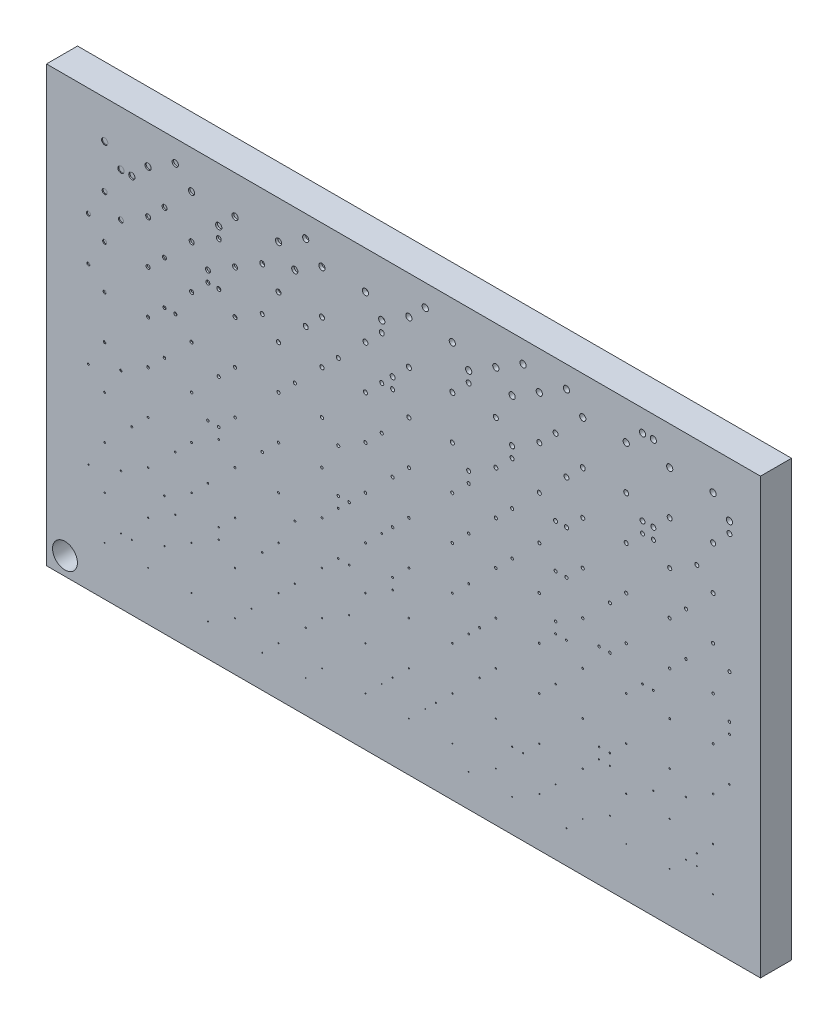
from build123d import *

# Parameters (mm, degrees)
SKETCH1_W            = 230
SKETCH1_H            = 140
BOSS_EXTRUDE1_DEPTH  = 10
SKETCH7_R            = 4
CUT_EXTRUDE5_DEPTH   = 10
SKETCH8_R            = 0.15
CUT_EXTRUDE6_DEPTH   = 0.3
SKETCH10_R           = 0.15
CUT_EXTRUDE7_DEPTH   = 0.4
SKETCH11_R           = 0.15
CUT_EXTRUDE8_DEPTH   = 0.5
SKETCH12_R           = 0.15
CUT_EXTRUDE9_DEPTH   = 0.6
SKETCH13_R           = 0.15
CUT_EXTRUDE10_DEPTH  = 0.8
SKETCH14_R           = 0.15
CUT_EXTRUDE11_DEPTH  = 1
SKETCH15_R           = 0.15
CUT_EXTRUDE12_DEPTH  = 1.3
SKETCH16_R           = 0.15
CUT_EXTRUDE13_DEPTH  = 1.6
SKETCH17_R           = 0.15
CUT_EXTRUDE14_DEPTH  = 2
SKETCH18_R           = 0.15
CUT_EXTRUDE15_DEPTH  = 2.5
SKETCH19_R           = 0.15
CUT_EXTRUDE16_DEPTH  = 3.2
SKETCH20_R           = 0.15
CUT_EXTRUDE17_DEPTH  = 4
SKETCH21_R           = 0.15
CUT_EXTRUDE18_DEPTH  = 5
SKETCH22_R           = 0.15
CUT_EXTRUDE19_DEPTH  = 6.3
SKETCH23_R           = 0.15
CUT_EXTRUDE20_DEPTH  = 8
SKETCH24_R           = 0.2
CUT_EXTRUDE21_DEPTH  = 0.3
SKETCH25_R           = 0.2
CUT_EXTRUDE22_DEPTH  = 0.4
SKETCH26_R           = 0.2
CUT_EXTRUDE23_DEPTH  = 0.5
SKETCH28_R           = 0.2
CUT_EXTRUDE25_DEPTH  = 0.6
SKETCH29_R           = 0.2
CUT_EXTRUDE26_DEPTH  = 0.8
SKETCH30_R           = 0.2
CUT_EXTRUDE27_DEPTH  = 1
SKETCH31_R           = 0.2
CUT_EXTRUDE28_DEPTH  = 1.3
SKETCH33_R           = 0.2
CUT_EXTRUDE29_DEPTH  = 1.6
SKETCH34_R           = 0.2
CUT_EXTRUDE30_DEPTH  = 2
SKETCH35_R           = 0.2
CUT_EXTRUDE31_DEPTH  = 2.5
SKETCH37_R           = 0.2
CUT_EXTRUDE32_DEPTH  = 3.2
SKETCH38_R           = 0.2
CUT_EXTRUDE33_DEPTH  = 4
SKETCH39_R           = 0.2
CUT_EXTRUDE34_DEPTH  = 5
SKETCH41_R           = 0.2
CUT_EXTRUDE35_DEPTH  = 6.3
SKETCH42_R           = 0.2
CUT_EXTRUDE36_DEPTH  = 8
SKETCH43_R           = 0.25
CUT_EXTRUDE37_DEPTH  = 0.3
SKETCH44_R           = 0.25
CUT_EXTRUDE38_DEPTH  = 0.4
SKETCH45_R           = 0.25
CUT_EXTRUDE39_DEPTH  = 0.5
SKETCH46_R           = 0.25
CUT_EXTRUDE40_DEPTH  = 0.6
SKETCH47_R           = 0.25
CUT_EXTRUDE41_DEPTH  = 0.8
SKETCH48_R           = 0.25
CUT_EXTRUDE42_DEPTH  = 1
SKETCH49_R           = 0.25
CUT_EXTRUDE43_DEPTH  = 1.3
SKETCH50_R           = 0.25
CUT_EXTRUDE44_DEPTH  = 1.6
SKETCH51_R           = 0.25
CUT_EXTRUDE45_DEPTH  = 2
SKETCH53_R           = 0.25
CUT_EXTRUDE46_DEPTH  = 2.5
SKETCH54_R           = 0.25
CUT_EXTRUDE47_DEPTH  = 3.2
SKETCH55_R           = 0.25
CUT_EXTRUDE48_DEPTH  = 4
SKETCH56_R           = 0.25
CUT_EXTRUDE49_DEPTH  = 5
SKETCH57_R           = 0.25
CUT_EXTRUDE50_DEPTH  = 6.3
SKETCH59_R           = 0.25
CUT_EXTRUDE51_DEPTH  = 8
SKETCH60_R           = 0.3
CUT_EXTRUDE52_DEPTH  = 0.3
SKETCH61_R           = 0.3
CUT_EXTRUDE53_DEPTH  = 0.4
SKETCH62_R           = 0.3
CUT_EXTRUDE54_DEPTH  = 0.5
SKETCH63_R           = 0.3
CUT_EXTRUDE55_DEPTH  = 0.6
SKETCH64_R           = 0.3
CUT_EXTRUDE56_DEPTH  = 0.8
SKETCH66_R           = 0.3
CUT_EXTRUDE57_DEPTH  = 1
SKETCH67_R           = 0.3
CUT_EXTRUDE58_DEPTH  = 1.3
SKETCH68_R           = 0.3
CUT_EXTRUDE59_DEPTH  = 1.6
SKETCH69_R           = 0.3
CUT_EXTRUDE60_DEPTH  = 2
SKETCH70_R           = 0.3
CUT_EXTRUDE61_DEPTH  = 2.5
SKETCH71_R           = 0.3
CUT_EXTRUDE62_DEPTH  = 3.2
SKETCH72_R           = 0.3
CUT_EXTRUDE63_DEPTH  = 4
SKETCH73_R           = 0.3
CUT_EXTRUDE64_DEPTH  = 5
SKETCH74_R           = 0.3
CUT_EXTRUDE65_DEPTH  = 6.3
SKETCH75_R           = 0.3
CUT_EXTRUDE66_DEPTH  = 8
SKETCH76_R           = 0.4
CUT_EXTRUDE67_DEPTH  = 0.3
SKETCH77_R           = 0.4
CUT_EXTRUDE68_DEPTH  = 0.4
SKETCH79_R           = 0.4
CUT_EXTRUDE69_DEPTH  = 0.5
SKETCH80_R           = 0.4
CUT_EXTRUDE70_DEPTH  = 0.6
SKETCH81_R           = 0.4
CUT_EXTRUDE71_DEPTH  = 0.8
SKETCH82_R           = 0.4
CUT_EXTRUDE72_DEPTH  = 1
SKETCH84_R           = 0.4
CUT_EXTRUDE73_DEPTH  = 1.3
SKETCH86_R           = 0.4
CUT_EXTRUDE74_DEPTH  = 1.6
SKETCH87_R           = 0.4
CUT_EXTRUDE75_DEPTH  = 2
SKETCH88_R           = 0.4
CUT_EXTRUDE76_DEPTH  = 2.5
SKETCH89_R           = 0.4
CUT_EXTRUDE77_DEPTH  = 3.2
SKETCH91_R           = 0.4
CUT_EXTRUDE78_DEPTH  = 4
SKETCH92_R           = 0.4
CUT_EXTRUDE79_DEPTH  = 5
SKETCH93_R           = 0.4
CUT_EXTRUDE80_DEPTH  = 6.3
SKETCH94_R           = 0.4
CUT_EXTRUDE81_DEPTH  = 8
SKETCH95_R           = 0.5
CUT_EXTRUDE82_DEPTH  = 0.3
SKETCH96_R           = 0.5
CUT_EXTRUDE83_DEPTH  = 0.4
SKETCH97_R           = 0.5
CUT_EXTRUDE84_DEPTH  = 0.5
SKETCH98_R           = 0.5
CUT_EXTRUDE85_DEPTH  = 0.6
SKETCH99_R           = 0.5
CUT_EXTRUDE86_DEPTH  = 0.8
SKETCH100_R          = 0.5
CUT_EXTRUDE87_DEPTH  = 1
SKETCH101_R          = 0.5
CUT_EXTRUDE88_DEPTH  = 1.3
SKETCH102_R          = 0.5
CUT_EXTRUDE89_DEPTH  = 1.6
SKETCH103_R          = 0.5
CUT_EXTRUDE90_DEPTH  = 2
SKETCH104_R          = 0.5
CUT_EXTRUDE91_DEPTH  = 2.5
SKETCH105_R          = 0.5
CUT_EXTRUDE92_DEPTH  = 3.2
SKETCH107_R          = 0.5
CUT_EXTRUDE93_DEPTH  = 4
SKETCH108_R          = 0.5
CUT_EXTRUDE94_DEPTH  = 5
SKETCH109_R          = 0.5
CUT_EXTRUDE95_DEPTH  = 6.3
SKETCH111_R          = 0.5
CUT_EXTRUDE96_DEPTH  = 8
SKETCH112_R          = 0.65
CUT_EXTRUDE97_DEPTH  = 0.3
SKETCH113_R          = 0.65
CUT_EXTRUDE98_DEPTH  = 0.4
SKETCH114_R          = 0.65
CUT_EXTRUDE99_DEPTH  = 0.5
SKETCH115_R          = 0.65
CUT_EXTRUDE100_DEPTH = 0.6
SKETCH116_R          = 0.65
CUT_EXTRUDE101_DEPTH = 0.8
SKETCH117_R          = 0.65
CUT_EXTRUDE102_DEPTH = 1
SKETCH118_R          = 0.65
CUT_EXTRUDE103_DEPTH = 1.3
SKETCH120_R          = 0.65
CUT_EXTRUDE104_DEPTH = 1.6
SKETCH121_R          = 0.65
CUT_EXTRUDE105_DEPTH = 2
SKETCH122_R          = 0.65
CUT_EXTRUDE106_DEPTH = 2.5
SKETCH124_R          = 0.65
CUT_EXTRUDE107_DEPTH = 3.2
SKETCH125_R          = 0.65
CUT_EXTRUDE108_DEPTH = 4
SKETCH127_R          = 0.65
CUT_EXTRUDE109_DEPTH = 5
SKETCH129_R          = 0.65
CUT_EXTRUDE110_DEPTH = 6.3
SKETCH130_R          = 0.65
CUT_EXTRUDE111_DEPTH = 8
SKETCH131_R          = 0.8
CUT_EXTRUDE112_DEPTH = 0.3
SKETCH132_R          = 0.8
CUT_EXTRUDE113_DEPTH = 0.4
SKETCH134_R          = 0.8
CUT_EXTRUDE114_DEPTH = 0.5
SKETCH135_R          = 0.8
CUT_EXTRUDE115_DEPTH = 0.6
SKETCH136_R          = 0.8
CUT_EXTRUDE116_DEPTH = 0.8
SKETCH137_R          = 0.8
CUT_EXTRUDE117_DEPTH = 1
SKETCH138_R          = 0.8
CUT_EXTRUDE118_DEPTH = 1.3
SKETCH139_R          = 0.8
CUT_EXTRUDE119_DEPTH = 1.6
SKETCH140_R          = 0.8
CUT_EXTRUDE120_DEPTH = 2
SKETCH141_R          = 0.8
CUT_EXTRUDE121_DEPTH = 2.5
SKETCH142_R          = 0.8
CUT_EXTRUDE122_DEPTH = 3.2
SKETCH143_R          = 0.8
CUT_EXTRUDE123_DEPTH = 4
SKETCH144_R          = 0.8
CUT_EXTRUDE124_DEPTH = 5
SKETCH145_R          = 0.8
CUT_EXTRUDE125_DEPTH = 6.3
SKETCH146_R          = 0.8
CUT_EXTRUDE126_DEPTH = 8
SKETCH147_R          = 1
CUT_EXTRUDE127_DEPTH = 0.3
SKETCH148_R          = 1
CUT_EXTRUDE128_DEPTH = 0.4
SKETCH149_R          = 1
CUT_EXTRUDE129_DEPTH = 0.5
SKETCH151_R          = 1
CUT_EXTRUDE130_DEPTH = 0.6
SKETCH152_R          = 1
CUT_EXTRUDE131_DEPTH = 0.8
SKETCH153_R          = 1
CUT_EXTRUDE132_DEPTH = 1
SKETCH154_R          = 1
CUT_EXTRUDE133_DEPTH = 1.3
SKETCH155_R          = 1
CUT_EXTRUDE134_DEPTH = 1.6
SKETCH156_R          = 1
CUT_EXTRUDE135_DEPTH = 2
SKETCH157_R          = 1
CUT_EXTRUDE136_DEPTH = 2.5
SKETCH158_R          = 1
CUT_EXTRUDE137_DEPTH = 3.2
SKETCH159_R          = 1
CUT_EXTRUDE138_DEPTH = 4
SKETCH160_R          = 1
CUT_EXTRUDE139_DEPTH = 5
SKETCH161_R          = 1
CUT_EXTRUDE140_DEPTH = 6.3
SKETCH162_R          = 1
CUT_EXTRUDE141_DEPTH = 8


with BuildPart() as part:
    # Sketch1 → Boss-Extrude1 (new body)
    with BuildSketch(Plane.XY):
        Rectangle(SKETCH1_W, SKETCH1_H)
    extrude(amount=BOSS_EXTRUDE1_DEPTH)

    # Sketch7 → Cut-Extrude5 (cut)
    with BuildSketch(Plane.XY.offset(10)):
        with Locations((-109.042941977, -64.201258826)):
            Circle(SKETCH7_R)
    extrude(amount=-CUT_EXTRUDE5_DEPTH, mode=Mode.SUBTRACT)

    # Sketch8 → Cut-Extrude6 (cut)
    with BuildSketch(Plane.XY.offset(10)):
        with Locations((-96.249943399, -54.249679787)):
            Circle(SKETCH8_R)
        with Locations((-90.999874337, -48.998924968)):
            Circle(SKETCH8_R)
    extrude(amount=-CUT_EXTRUDE6_DEPTH, mode=Mode.SUBTRACT)

    # Sketch10 → Cut-Extrude7 (cut)
    with BuildSketch(Plane.XY.offset(10)):
        with Locations((-82.249491037, -54.249550816)):
            Circle(SKETCH10_R)
        with Locations((-87.501475083, -49.000981168)):
            Circle(SKETCH10_R)
    extrude(amount=-CUT_EXTRUDE7_DEPTH, mode=Mode.SUBTRACT)

    # Sketch11 → Cut-Extrude8 (cut)
    with BuildSketch(Plane.XY.offset(10)):
        with Locations((-68.261838039, -54.252904313)):
            Circle(SKETCH11_R)
        with Locations((-62.981710508, -59.519060019)):
            Circle(SKETCH11_R)
    extrude(amount=-CUT_EXTRUDE8_DEPTH, mode=Mode.SUBTRACT)

    # Sketch12 → Cut-Extrude9 (cut)
    with BuildSketch(Plane.XY.offset(10)):
        with Locations((-54.252810099, -54.248506301)):
            Circle(SKETCH12_R)
        with Locations((-49.000661176, -49.000211981)):
            Circle(SKETCH12_R)
    extrude(amount=-CUT_EXTRUDE9_DEPTH, mode=Mode.SUBTRACT)

    # Sketch13 → Cut-Extrude10 (cut)
    with BuildSketch(Plane.XY.offset(10)):
        with Locations((-40.253624595, -54.25930312)):
            Circle(SKETCH13_R)
        with Locations((-45.507827791, -59.507162167)):
            Circle(SKETCH13_R)
    extrude(amount=-CUT_EXTRUDE10_DEPTH, mode=Mode.SUBTRACT)

    # Sketch14 → Cut-Extrude11 (cut)
    with BuildSketch(Plane.XY.offset(10)):
        with Locations((-26.249884398, -54.24764395)):
            Circle(SKETCH14_R)
        with Locations((-31.499792921, -59.499721302)):
            Circle(SKETCH14_R)
    extrude(amount=-CUT_EXTRUDE11_DEPTH, mode=Mode.SUBTRACT)

    # Sketch15 → Cut-Extrude12 (cut)
    with BuildSketch(Plane.XY.offset(10)):
        with Locations((-12.250506084, -54.250247714)):
            Circle(SKETCH15_R)
        with Locations((-6.999236045, -49.000434159)):
            Circle(SKETCH15_R)
    extrude(amount=-CUT_EXTRUDE12_DEPTH, mode=Mode.SUBTRACT)

    # Sketch16 → Cut-Extrude13 (cut)
    with BuildSketch(Plane.XY.offset(10)):
        with Locations((1.750604588, -54.251162541)):
            Circle(SKETCH16_R)
        with Locations((7.000082749, -49.000605939)):
            Circle(SKETCH16_R)
    extrude(amount=-CUT_EXTRUDE13_DEPTH, mode=Mode.SUBTRACT)

    # Sketch17 → Cut-Extrude14 (cut)
    with BuildSketch(Plane.XY.offset(10)):
        with Locations((15.750210434, -54.250994624)):
            Circle(SKETCH17_R)
        with Locations((20.999440385, -59.501475674)):
            Circle(SKETCH17_R)
    extrude(amount=-CUT_EXTRUDE14_DEPTH, mode=Mode.SUBTRACT)

    # Sketch18 → Cut-Extrude15 (cut)
    with BuildSketch(Plane.XY.offset(10)):
        with Locations((29.752072794, -54.247371691)):
            Circle(SKETCH18_R)
        with Locations((35.00012008, -59.500341576)):
            Circle(SKETCH18_R)
    extrude(amount=-CUT_EXTRUDE15_DEPTH, mode=Mode.SUBTRACT)

    # Sketch19 → Cut-Extrude16 (cut)
    with BuildSketch(Plane.XY.offset(10)):
        with Locations((43.774415439, -54.237890934)):
            Circle(SKETCH19_R)
        with Locations((49.016100038, -49.026342575)):
            Circle(SKETCH19_R)
    extrude(amount=-CUT_EXTRUDE16_DEPTH, mode=Mode.SUBTRACT)

    # Sketch20 → Cut-Extrude17 (cut)
    with BuildSketch(Plane.XY.offset(10)):
        with Locations((57.746432811, -54.253474775)):
            Circle(SKETCH20_R)
        with Locations((52.499861717, -59.500791765)):
            Circle(SKETCH20_R)
    extrude(amount=-CUT_EXTRUDE17_DEPTH, mode=Mode.SUBTRACT)

    # Sketch21 → Cut-Extrude18 (cut)
    with BuildSketch(Plane.XY.offset(10)):
        with Locations((71.750133446, -54.253155508)):
            Circle(SKETCH21_R)
        with Locations((66.500129392, -48.999906121)):
            Circle(SKETCH21_R)
    extrude(amount=-CUT_EXTRUDE18_DEPTH, mode=Mode.SUBTRACT)

    # Sketch22 → Cut-Extrude19 (cut)
    with BuildSketch(Plane.XY.offset(10)):
        with Locations((85.750887917, -54.253149119)):
            Circle(SKETCH22_R)
        with Locations((91.000252872, -49.001105902)):
            Circle(SKETCH22_R)
    extrude(amount=-CUT_EXTRUDE19_DEPTH, mode=Mode.SUBTRACT)

    # Sketch23 → Cut-Extrude20 (cut)
    with BuildSketch(Plane.XY.offset(10)):
        with Locations((99.749573037, -54.251102866)):
            Circle(SKETCH23_R)
        with Locations((94.498823547, -49.001471895)):
            Circle(SKETCH23_R)
    extrude(amount=-CUT_EXTRUDE20_DEPTH, mode=Mode.SUBTRACT)

    # Sketch24 → Cut-Extrude21 (cut)
    with BuildSketch(Plane.XY.offset(10)):
        with Locations((-96.248580982, -40.246762901)):
            Circle(SKETCH24_R)
        with Locations((-101.487437659, -35.005366334)):
            Circle(SKETCH24_R)
    extrude(amount=-CUT_EXTRUDE21_DEPTH, mode=Mode.SUBTRACT)

    # Sketch25 → Cut-Extrude22 (cut)
    with BuildSketch(Plane.XY.offset(10)):
        with Locations((-82.247762838, -40.256089431)):
            Circle(SKETCH25_R)
        with Locations((-76.998898501, -45.499448138)):
            Circle(SKETCH25_R)
    extrude(amount=-CUT_EXTRUDE22_DEPTH, mode=Mode.SUBTRACT)

    # Sketch26 → Cut-Extrude23 (cut)
    with BuildSketch(Plane.XY.offset(10)):
        with Locations((-68.241657512, -40.258834454)):
            Circle(SKETCH26_R)
        with Locations((-73.49008197, -34.995352001)):
            Circle(SKETCH26_R)
    extrude(amount=-CUT_EXTRUDE23_DEPTH, mode=Mode.SUBTRACT)

    # Sketch28 → Cut-Extrude25 (cut)
    with BuildSketch(Plane.XY.offset(10)):
        with Locations((-54.250214592, -40.255115508)):
            Circle(SKETCH28_R)
        with Locations((-59.501935253, -35.004284698)):
            Circle(SKETCH28_R)
    extrude(amount=-CUT_EXTRUDE25_DEPTH, mode=Mode.SUBTRACT)

    # Sketch29 → Cut-Extrude26 (cut)
    with BuildSketch(Plane.XY.offset(10)):
        with Locations((-40.255041187, -40.251054217)):
            Circle(SKETCH29_R)
        with Locations((-34.998488594, -35.002201595)):
            Circle(SKETCH29_R)
    extrude(amount=-CUT_EXTRUDE26_DEPTH, mode=Mode.SUBTRACT)

    # Sketch30 → Cut-Extrude27 (cut)
    with BuildSketch(Plane.XY.offset(10)):
        with Locations((-26.247963529, -40.254747535)):
            Circle(SKETCH30_R)
        with Locations((-31.498700128, -45.51436591)):
            Circle(SKETCH30_R)
    extrude(amount=-CUT_EXTRUDE27_DEPTH, mode=Mode.SUBTRACT)

    # Sketch31 → Cut-Extrude28 (cut)
    with BuildSketch(Plane.XY.offset(10)):
        with Locations((-12.248658261, -40.248036469)):
            Circle(SKETCH31_R)
        with Locations((-17.505338259, -34.998920094)):
            Circle(SKETCH31_R)
    extrude(amount=-CUT_EXTRUDE28_DEPTH, mode=Mode.SUBTRACT)

    # Sketch33 → Cut-Extrude29 (cut)
    with BuildSketch(Plane.XY.offset(10)):
        with Locations((1.753113594, -40.247359153)):
            Circle(SKETCH33_R)
        with Locations((-3.505543052, -45.503072676)):
            Circle(SKETCH33_R)
    extrude(amount=-CUT_EXTRUDE29_DEPTH, mode=Mode.SUBTRACT)

    # Sketch34 → Cut-Extrude30 (cut)
    with BuildSketch(Plane.XY.offset(10)):
        with Locations((15.75256569, -40.253964375)):
            Circle(SKETCH34_R)
        with Locations((10.50057115, -45.502722883)):
            Circle(SKETCH34_R)
    extrude(amount=-CUT_EXTRUDE30_DEPTH, mode=Mode.SUBTRACT)

    # Sketch35 → Cut-Extrude31 (cut)
    with BuildSketch(Plane.XY.offset(10)):
        with Locations((29.748102112, -40.247524967)):
            Circle(SKETCH35_R)
        with Locations((35.004594047, -45.50551431)):
            Circle(SKETCH35_R)
    extrude(amount=-CUT_EXTRUDE31_DEPTH, mode=Mode.SUBTRACT)

    # Sketch37 → Cut-Extrude32 (cut)
    with BuildSketch(Plane.XY.offset(10)):
        with Locations((43.752366978, -40.251913533)):
            Circle(SKETCH37_R)
        with Locations((38.496933643, -45.506209212)):
            Circle(SKETCH37_R)
    extrude(amount=-CUT_EXTRUDE32_DEPTH, mode=Mode.SUBTRACT)

    # Sketch38 → Cut-Extrude33 (cut)
    with BuildSketch(Plane.XY.offset(10)):
        with Locations((57.749027025, -40.250908504)):
            Circle(SKETCH38_R)
        with Locations((63.002579099, -35.016712104)):
            Circle(SKETCH38_R)
    extrude(amount=-CUT_EXTRUDE33_DEPTH, mode=Mode.SUBTRACT)

    # Sketch39 → Cut-Extrude34 (cut)
    with BuildSketch(Plane.XY.offset(10)):
        with Locations((71.749376563, -40.251866978)):
            Circle(SKETCH39_R)
        with Locations((66.503102808, -35.018953964)):
            Circle(SKETCH39_R)
    extrude(amount=-CUT_EXTRUDE34_DEPTH, mode=Mode.SUBTRACT)

    # Sketch41 → Cut-Extrude35 (cut)
    with BuildSketch(Plane.XY.offset(10)):
        with Locations((85.75304853, -40.249924221)):
            Circle(SKETCH41_R)
        with Locations((80.492907487, -35.000078663)):
            Circle(SKETCH41_R)
    extrude(amount=-CUT_EXTRUDE35_DEPTH, mode=Mode.SUBTRACT)

    # Sketch42 → Cut-Extrude36 (cut)
    with BuildSketch(Plane.XY.offset(10)):
        with Locations((99.748726349, -40.250300142)):
            Circle(SKETCH42_R)
        with Locations((94.499191724, -45.499275702)):
            Circle(SKETCH42_R)
    extrude(amount=-CUT_EXTRUDE36_DEPTH, mode=Mode.SUBTRACT)

    # Sketch43 → Cut-Extrude37 (cut)
    with BuildSketch(Plane.XY.offset(10)):
        with Locations((-96.258260655, -26.246155762)):
            Circle(SKETCH43_R)
        with Locations((-90.995156769, -31.508068016)):
            Circle(SKETCH43_R)
    extrude(amount=-CUT_EXTRUDE37_DEPTH, mode=Mode.SUBTRACT)

    # Sketch44 → Cut-Extrude38 (cut)
    with BuildSketch(Plane.XY.offset(10)):
        with Locations((-82.246236366, -26.246781643)):
            Circle(SKETCH44_R)
        with Locations((-76.996676425, -31.506208621)):
            Circle(SKETCH44_R)
    extrude(amount=-CUT_EXTRUDE38_DEPTH, mode=Mode.SUBTRACT)

    # Sketch45 → Cut-Extrude39 (cut)
    with BuildSketch(Plane.XY.offset(10)):
        with Locations((-68.245839858, -26.254858809)):
            Circle(SKETCH45_R)
        with Locations((-63.001301145, -21.00345891)):
            Circle(SKETCH45_R)
    extrude(amount=-CUT_EXTRUDE39_DEPTH, mode=Mode.SUBTRACT)

    # Sketch46 → Cut-Extrude40 (cut)
    with BuildSketch(Plane.XY.offset(10)):
        with Locations((-54.253861977, -26.252451768)):
            Circle(SKETCH46_R)
        with Locations((-59.504120315, -31.513139409)):
            Circle(SKETCH46_R)
    extrude(amount=-CUT_EXTRUDE40_DEPTH, mode=Mode.SUBTRACT)

    # Sketch47 → Cut-Extrude41 (cut)
    with BuildSketch(Plane.XY.offset(10)):
        with Locations((-40.248888006, -26.252967104)):
            Circle(SKETCH47_R)
        with Locations((-45.498075131, -31.502017026)):
            Circle(SKETCH47_R)
    extrude(amount=-CUT_EXTRUDE41_DEPTH, mode=Mode.SUBTRACT)

    # Sketch48 → Cut-Extrude42 (cut)
    with BuildSketch(Plane.XY.offset(10)):
        with Locations((-26.249534477, -26.252292502)):
            Circle(SKETCH48_R)
        with Locations((-21.000233226, -21.001330328)):
            Circle(SKETCH48_R)
    extrude(amount=-CUT_EXTRUDE42_DEPTH, mode=Mode.SUBTRACT)

    # Sketch49 → Cut-Extrude43 (cut)
    with BuildSketch(Plane.XY.offset(10)):
        with Locations((-12.250518947, -26.263174953)):
            Circle(SKETCH49_R)
        with Locations((-17.498656895, -21.001685128)):
            Circle(SKETCH49_R)
    extrude(amount=-CUT_EXTRUDE43_DEPTH, mode=Mode.SUBTRACT)

    # Sketch50 → Cut-Extrude44 (cut)
    with BuildSketch(Plane.XY.offset(10)):
        with Locations((1.747078239, -26.250665841)):
            Circle(SKETCH50_R)
        with Locations((-3.499137814, -21.000073457)):
            Circle(SKETCH50_R)
    extrude(amount=-CUT_EXTRUDE44_DEPTH, mode=Mode.SUBTRACT)

    # Sketch51 → Cut-Extrude45 (cut)
    with BuildSketch(Plane.XY.offset(10)):
        with Locations((15.74714847, -26.253750394)):
            Circle(SKETCH51_R)
        with Locations((21.005127475, -21.001038767)):
            Circle(SKETCH51_R)
    extrude(amount=-CUT_EXTRUDE45_DEPTH, mode=Mode.SUBTRACT)

    # Sketch53 → Cut-Extrude46 (cut)
    with BuildSketch(Plane.XY.offset(10)):
        with Locations((29.749468874, -26.252393022)):
            Circle(SKETCH53_R)
        with Locations((24.498265186, -31.504435786)):
            Circle(SKETCH53_R)
    extrude(amount=-CUT_EXTRUDE46_DEPTH, mode=Mode.SUBTRACT)

    # Sketch54 → Cut-Extrude47 (cut)
    with BuildSketch(Plane.XY.offset(10)):
        with Locations((43.745660862, -26.251733364)):
            Circle(SKETCH54_R)
        with Locations((48.998900888, -21.004340385)):
            Circle(SKETCH54_R)
    extrude(amount=-CUT_EXTRUDE47_DEPTH, mode=Mode.SUBTRACT)

    # Sketch55 → Cut-Extrude48 (cut)
    with BuildSketch(Plane.XY.offset(10)):
        with Locations((57.758821326, -26.252380091)):
            Circle(SKETCH55_R)
        with Locations((62.998459982, -31.50919707)):
            Circle(SKETCH55_R)
    extrude(amount=-CUT_EXTRUDE48_DEPTH, mode=Mode.SUBTRACT)

    # Sketch56 → Cut-Extrude49 (cut)
    with BuildSketch(Plane.XY.offset(10)):
        with Locations((71.750106799, -26.2511108)):
            Circle(SKETCH56_R)
        with Locations((66.499773166, -31.496255601)):
            Circle(SKETCH56_R)
    extrude(amount=-CUT_EXTRUDE49_DEPTH, mode=Mode.SUBTRACT)

    # Sketch57 → Cut-Extrude50 (cut)
    with BuildSketch(Plane.XY.offset(10)):
        with Locations((85.745680987, -26.246276163)):
            Circle(SKETCH57_R)
        with Locations((91.000977888, -31.499259395)):
            Circle(SKETCH57_R)
    extrude(amount=-CUT_EXTRUDE50_DEPTH, mode=Mode.SUBTRACT)

    # Sketch59 → Cut-Extrude51 (cut)
    with BuildSketch(Plane.XY.offset(10)):
        with Locations((99.745130194, -26.257684623)):
            Circle(SKETCH59_R)
        with Locations((104.997528224, -21.00814684)):
            Circle(SKETCH59_R)
    extrude(amount=-CUT_EXTRUDE51_DEPTH, mode=Mode.SUBTRACT)

    # Sketch60 → Cut-Extrude52 (cut)
    with BuildSketch(Plane.XY.offset(10)):
        with Locations((-96.25461941, -12.254982082)):
            Circle(SKETCH60_R)
        with Locations((-101.496054707, -7.001558372)):
            Circle(SKETCH60_R)
    extrude(amount=-CUT_EXTRUDE52_DEPTH, mode=Mode.SUBTRACT)

    # Sketch61 → Cut-Extrude53 (cut)
    with BuildSketch(Plane.XY.offset(10)):
        with Locations((-82.249702768, -12.255549457)):
            Circle(SKETCH61_R)
        with Locations((-87.495433778, -17.508401752)):
            Circle(SKETCH61_R)
    extrude(amount=-CUT_EXTRUDE53_DEPTH, mode=Mode.SUBTRACT)

    # Sketch62 → Cut-Extrude54 (cut)
    with BuildSketch(Plane.XY.offset(10)):
        with Locations((-68.256273037, -12.252316731)):
            Circle(SKETCH62_R)
        with Locations((-73.499195041, -17.499822394)):
            Circle(SKETCH62_R)
    extrude(amount=-CUT_EXTRUDE54_DEPTH, mode=Mode.SUBTRACT)

    # Sketch63 → Cut-Extrude55 (cut)
    with BuildSketch(Plane.XY.offset(10)):
        with Locations((-54.261477101, -12.254031728)):
            Circle(SKETCH63_R)
        with Locations((-59.503654233, -7.013051134)):
            Circle(SKETCH63_R)
    extrude(amount=-CUT_EXTRUDE55_DEPTH, mode=Mode.SUBTRACT)

    # Sketch64 → Cut-Extrude56 (cut)
    with BuildSketch(Plane.XY.offset(10)):
        with Locations((-40.256412294, -12.25990674)):
            Circle(SKETCH64_R)
        with Locations((-34.985105884, -17.510019631)):
            Circle(SKETCH64_R)
    extrude(amount=-CUT_EXTRUDE56_DEPTH, mode=Mode.SUBTRACT)

    # Sketch66 → Cut-Extrude57 (cut)
    with BuildSketch(Plane.XY.offset(10)):
        with Locations((-26.249363164, -12.256234414)):
            Circle(SKETCH66_R)
        with Locations((-20.995782229, -7.000188989)):
            Circle(SKETCH66_R)
    extrude(amount=-CUT_EXTRUDE57_DEPTH, mode=Mode.SUBTRACT)

    # Sketch67 → Cut-Extrude58 (cut)
    with BuildSketch(Plane.XY.offset(10)):
        with Locations((-12.235726323, -12.244715067)):
            Circle(SKETCH67_R)
        with Locations((-6.992278399, -6.992240498)):
            Circle(SKETCH67_R)
    extrude(amount=-CUT_EXTRUDE58_DEPTH, mode=Mode.SUBTRACT)

    # Sketch68 → Cut-Extrude59 (cut)
    with BuildSketch(Plane.XY.offset(10)):
        with Locations((1.754534448, -12.255377325)):
            Circle(SKETCH68_R)
        with Locations((-3.502755421, -17.512225307)):
            Circle(SKETCH68_R)
    extrude(amount=-CUT_EXTRUDE59_DEPTH, mode=Mode.SUBTRACT)

    # Sketch69 → Cut-Extrude60 (cut)
    with BuildSketch(Plane.XY.offset(10)):
        with Locations((15.744877643, -12.256861819)):
            Circle(SKETCH69_R)
        with Locations((21.009841361, -7.006344924)):
            Circle(SKETCH69_R)
    extrude(amount=-CUT_EXTRUDE60_DEPTH, mode=Mode.SUBTRACT)

    # Sketch70 → Cut-Extrude61 (cut)
    with BuildSketch(Plane.XY.offset(10)):
        with Locations((29.750196944, -12.25523678)):
            Circle(SKETCH70_R)
        with Locations((24.508410735, -17.507782073)):
            Circle(SKETCH70_R)
    extrude(amount=-CUT_EXTRUDE61_DEPTH, mode=Mode.SUBTRACT)

    # Sketch71 → Cut-Extrude62 (cut)
    with BuildSketch(Plane.XY.offset(10)):
        with Locations((43.749681369, -12.247569805)):
            Circle(SKETCH71_R)
        with Locations((49.010128442, -7.012307344)):
            Circle(SKETCH71_R)
    extrude(amount=-CUT_EXTRUDE62_DEPTH, mode=Mode.SUBTRACT)

    # Sketch72 → Cut-Extrude63 (cut)
    with BuildSketch(Plane.XY.offset(10)):
        with Locations((57.751822731, -12.250577711)):
            Circle(SKETCH72_R)
        with Locations((52.507482907, -7.006693568)):
            Circle(SKETCH72_R)
    extrude(amount=-CUT_EXTRUDE63_DEPTH, mode=Mode.SUBTRACT)

    # Sketch73 → Cut-Extrude64 (cut)
    with BuildSketch(Plane.XY.offset(10)):
        with Locations((71.751379788, -12.256276649)):
            Circle(SKETCH73_R)
        with Locations((77.008894323, -7.000614382)):
            Circle(SKETCH73_R)
    extrude(amount=-CUT_EXTRUDE64_DEPTH, mode=Mode.SUBTRACT)

    # Sketch74 → Cut-Extrude65 (cut)
    with BuildSketch(Plane.XY.offset(10)):
        with Locations((85.747522124, -12.255884681)):
            Circle(SKETCH74_R)
        with Locations((80.48721955, -7.017622462)):
            Circle(SKETCH74_R)
    extrude(amount=-CUT_EXTRUDE65_DEPTH, mode=Mode.SUBTRACT)

    # Sketch75 → Cut-Extrude66 (cut)
    with BuildSketch(Plane.XY.offset(10)):
        with Locations((99.750293157, -12.246014661)):
            Circle(SKETCH75_R)
        with Locations((105.008200327, -7.001854225)):
            Circle(SKETCH75_R)
    extrude(amount=-CUT_EXTRUDE66_DEPTH, mode=Mode.SUBTRACT)

    # Sketch76 → Cut-Extrude67 (cut)
    with BuildSketch(Plane.XY.offset(10)):
        with Locations((-96.256583394, 1.745037788)):
            Circle(SKETCH76_R)
        with Locations((-91.013760875, -3.510944558)):
            Circle(SKETCH76_R)
    extrude(amount=-CUT_EXTRUDE67_DEPTH, mode=Mode.SUBTRACT)

    # Sketch77 → Cut-Extrude68 (cut)
    with BuildSketch(Plane.XY.offset(10)):
        with Locations((-82.267945504, 1.74429573)):
            Circle(SKETCH77_R)
        with Locations((-76.99594702, 7.011009175)):
            Circle(SKETCH77_R)
    extrude(amount=-CUT_EXTRUDE68_DEPTH, mode=Mode.SUBTRACT)

    # Sketch79 → Cut-Extrude69 (cut)
    with BuildSketch(Plane.XY.offset(10)):
        with Locations((-68.243934678, 1.733705426)):
            Circle(SKETCH79_R)
        with Locations((-62.996167745, -3.503696544)):
            Circle(SKETCH79_R)
    extrude(amount=-CUT_EXTRUDE69_DEPTH, mode=Mode.SUBTRACT)

    # Sketch80 → Cut-Extrude70 (cut)
    with BuildSketch(Plane.XY.offset(10)):
        with Locations((-54.251249908, 1.765534097)):
            Circle(SKETCH80_R)
        with Locations((-59.520350985, -3.520379165)):
            Circle(SKETCH80_R)
    extrude(amount=-CUT_EXTRUDE70_DEPTH, mode=Mode.SUBTRACT)

    # Sketch81 → Cut-Extrude71 (cut)
    with BuildSketch(Plane.XY.offset(10)):
        with Locations((-40.248153453, 1.749155114)):
            Circle(SKETCH81_R)
        with Locations((-45.500869729, -3.498012955)):
            Circle(SKETCH81_R)
    extrude(amount=-CUT_EXTRUDE71_DEPTH, mode=Mode.SUBTRACT)

    # Sketch82 → Cut-Extrude72 (cut)
    with BuildSketch(Plane.XY.offset(10)):
        with Locations((-26.275244446, 1.747317935)):
            Circle(SKETCH82_R)
        with Locations((-20.995127723, -3.511666179)):
            Circle(SKETCH82_R)
    extrude(amount=-CUT_EXTRUDE72_DEPTH, mode=Mode.SUBTRACT)

    # Sketch84 → Cut-Extrude73 (cut)
    with BuildSketch(Plane.XY.offset(10)):
        with Locations((-17.49932612, -3.50528826)):
            Circle(SKETCH84_R)
        with Locations((-12.25260791, 1.741448509)):
            Circle(SKETCH84_R)
    extrude(amount=-CUT_EXTRUDE73_DEPTH, mode=Mode.SUBTRACT)

    # Sketch86 → Cut-Extrude74 (cut)
    with BuildSketch(Plane.XY.offset(10)):
        with Locations((1.745039535, 1.741339349)):
            Circle(SKETCH86_R)
        with Locations((-3.495151051, -3.499839168)):
            Circle(SKETCH86_R)
    extrude(amount=-CUT_EXTRUDE74_DEPTH, mode=Mode.SUBTRACT)

    # Sketch87 → Cut-Extrude75 (cut)
    with BuildSketch(Plane.XY.offset(10)):
        with Locations((15.753560639, 1.741921375)):
            Circle(SKETCH87_R)
        with Locations((20.998717742, 6.99455625)):
            Circle(SKETCH87_R)
    extrude(amount=-CUT_EXTRUDE75_DEPTH, mode=Mode.SUBTRACT)

    # Sketch88 → Cut-Extrude76 (cut)
    with BuildSketch(Plane.XY.offset(10)):
        with Locations((29.752879785, 1.744489346)):
            Circle(SKETCH88_R)
        with Locations((34.998072316, 6.999515852)):
            Circle(SKETCH88_R)
    extrude(amount=-CUT_EXTRUDE76_DEPTH, mode=Mode.SUBTRACT)

    # Sketch89 → Cut-Extrude77 (cut)
    with BuildSketch(Plane.XY.offset(10)):
        with Locations((43.75017786, 1.745936963)):
            Circle(SKETCH89_R)
        with Locations((49.005887391, -3.502826203)):
            Circle(SKETCH89_R)
    extrude(amount=-CUT_EXTRUDE77_DEPTH, mode=Mode.SUBTRACT)

    # Sketch91 → Cut-Extrude78 (cut)
    with BuildSketch(Plane.XY.offset(10)):
        with Locations((57.753720356, 1.743193014)):
            Circle(SKETCH91_R)
        with Locations((62.997964049, -3.506252634)):
            Circle(SKETCH91_R)
    extrude(amount=-CUT_EXTRUDE78_DEPTH, mode=Mode.SUBTRACT)

    # Sketch92 → Cut-Extrude79 (cut)
    with BuildSketch(Plane.XY.offset(10)):
        with Locations((71.755179572, 1.748871745)):
            Circle(SKETCH92_R)
        with Locations((66.500637637, -3.508095525)):
            Circle(SKETCH92_R)
    extrude(amount=-CUT_EXTRUDE79_DEPTH, mode=Mode.SUBTRACT)

    # Sketch93 → Cut-Extrude80 (cut)
    with BuildSketch(Plane.XY.offset(10)):
        with Locations((85.750811485, 1.745076542)):
            Circle(SKETCH93_R)
        with Locations((91.001271487, 6.997269486)):
            Circle(SKETCH93_R)
    extrude(amount=-CUT_EXTRUDE80_DEPTH, mode=Mode.SUBTRACT)

    # Sketch94 → Cut-Extrude81 (cut)
    with BuildSketch(Plane.XY.offset(10)):
        with Locations((99.746171259, 1.752722936)):
            Circle(SKETCH94_R)
        with Locations((104.99891717, -3.502294608)):
            Circle(SKETCH94_R)
    extrude(amount=-CUT_EXTRUDE81_DEPTH, mode=Mode.SUBTRACT)

    # Sketch95 → Cut-Extrude82 (cut)
    with BuildSketch(Plane.XY.offset(10)):
        with Locations((-96.250638493, 15.744057262)):
            Circle(SKETCH95_R)
        with Locations((-101.502974448, 20.988191795)):
            Circle(SKETCH95_R)
    extrude(amount=-CUT_EXTRUDE82_DEPTH, mode=Mode.SUBTRACT)

    # Sketch96 → Cut-Extrude83 (cut)
    with BuildSketch(Plane.XY.offset(10)):
        with Locations((-82.24798045, 15.745788469)):
            Circle(SKETCH96_R)
        with Locations((-77.005498583, 21.006159684)):
            Circle(SKETCH96_R)
    extrude(amount=-CUT_EXTRUDE83_DEPTH, mode=Mode.SUBTRACT)

    # Sketch97 → Cut-Extrude84 (cut)
    with BuildSketch(Plane.XY.offset(10)):
        with Locations((-68.278960707, 15.760908762)):
            Circle(SKETCH97_R)
        with Locations((-73.503502628, 20.997795266)):
            Circle(SKETCH97_R)
    extrude(amount=-CUT_EXTRUDE84_DEPTH, mode=Mode.SUBTRACT)

    # Sketch98 → Cut-Extrude85 (cut)
    with BuildSketch(Plane.XY.offset(10)):
        with Locations((-54.254299355, 15.726426503)):
            Circle(SKETCH98_R)
        with Locations((-59.508179062, 10.505249293)):
            Circle(SKETCH98_R)
    extrude(amount=-CUT_EXTRUDE85_DEPTH, mode=Mode.SUBTRACT)

    # Sketch99 → Cut-Extrude86 (cut)
    with BuildSketch(Plane.XY.offset(10)):
        with Locations((-40.252502077, 15.740154945)):
            Circle(SKETCH99_R)
        with Locations((-35.004434074, 20.997857987)):
            Circle(SKETCH99_R)
    extrude(amount=-CUT_EXTRUDE86_DEPTH, mode=Mode.SUBTRACT)

    # Sketch100 → Cut-Extrude87 (cut)
    with BuildSketch(Plane.XY.offset(10)):
        with Locations((-26.250493908, 15.738463029)):
            Circle(SKETCH100_R)
        with Locations((-21.003457086, 10.486739875)):
            Circle(SKETCH100_R)
    extrude(amount=-CUT_EXTRUDE87_DEPTH, mode=Mode.SUBTRACT)

    # Sketch101 → Cut-Extrude88 (cut)
    with BuildSketch(Plane.XY.offset(10)):
        with Locations((-12.247706719, 15.749402948)):
            Circle(SKETCH101_R)
        with Locations((-7.002060246, 21.000797582)):
            Circle(SKETCH101_R)
    extrude(amount=-CUT_EXTRUDE88_DEPTH, mode=Mode.SUBTRACT)

    # Sketch102 → Cut-Extrude89 (cut)
    with BuildSketch(Plane.XY.offset(10)):
        with Locations((1.749935627, 15.750935192)):
            Circle(SKETCH102_R)
        with Locations((-3.510999042, 10.513456801)):
            Circle(SKETCH102_R)
    extrude(amount=-CUT_EXTRUDE89_DEPTH, mode=Mode.SUBTRACT)

    # Sketch103 → Cut-Extrude90 (cut)
    with BuildSketch(Plane.XY.offset(10)):
        with Locations((15.696931362, 15.714918937)):
            Circle(SKETCH103_R)
        with Locations((21.005731149, 20.984681778)):
            Circle(SKETCH103_R)
    extrude(amount=-CUT_EXTRUDE90_DEPTH, mode=Mode.SUBTRACT)

    # Sketch104 → Cut-Extrude91 (cut)
    with BuildSketch(Plane.XY.offset(10)):
        with Locations((29.748459984, 15.717807431)):
            Circle(SKETCH104_R)
        with Locations((35.00278024, 21.000871607)):
            Circle(SKETCH104_R)
    extrude(amount=-CUT_EXTRUDE91_DEPTH, mode=Mode.SUBTRACT)

    # Sketch105 → Cut-Extrude92 (cut)
    with BuildSketch(Plane.XY.offset(10)):
        with Locations((43.751363519, 15.75319775)):
            Circle(SKETCH105_R)
        with Locations((49.008821776, 10.4938201)):
            Circle(SKETCH105_R)
    extrude(amount=-CUT_EXTRUDE92_DEPTH, mode=Mode.SUBTRACT)

    # Sketch107 → Cut-Extrude93 (cut)
    with BuildSketch(Plane.XY.offset(10)):
        with Locations((57.746577319, 15.739508619)):
            Circle(SKETCH107_R)
        with Locations((52.49884189, 10.482804424)):
            Circle(SKETCH107_R)
    extrude(amount=-CUT_EXTRUDE93_DEPTH, mode=Mode.SUBTRACT)

    # Sketch108 → Cut-Extrude94 (cut)
    with BuildSketch(Plane.XY.offset(10)):
        with Locations((71.753133339, 15.742704267)):
            Circle(SKETCH108_R)
        with Locations((66.491814203, 10.418655333)):
            Circle(SKETCH108_R)
    extrude(amount=-CUT_EXTRUDE94_DEPTH, mode=Mode.SUBTRACT)

    # Sketch109 → Cut-Extrude95 (cut)
    with BuildSketch(Plane.XY.offset(10)):
        with Locations((85.74885942, 15.744188261)):
            Circle(SKETCH109_R)
        with Locations((91.003364969, 20.979796809)):
            Circle(SKETCH109_R)
    extrude(amount=-CUT_EXTRUDE95_DEPTH, mode=Mode.SUBTRACT)

    # Sketch111 → Cut-Extrude96 (cut)
    with BuildSketch(Plane.XY.offset(10)):
        with Locations((99.735351821, 15.754830047)):
            Circle(SKETCH111_R)
        with Locations((105.002478677, 10.479322531)):
            Circle(SKETCH111_R)
    extrude(amount=-CUT_EXTRUDE96_DEPTH, mode=Mode.SUBTRACT)

    # Sketch112 → Cut-Extrude97 (cut)
    with BuildSketch(Plane.XY.offset(10)):
        with Locations((-96.251445716, 29.740774992)):
            Circle(SKETCH112_R)
        with Locations((-101.493800667, 34.994303114)):
            Circle(SKETCH112_R)
    extrude(amount=-CUT_EXTRUDE97_DEPTH, mode=Mode.SUBTRACT)

    # Sketch113 → Cut-Extrude98 (cut)
    with BuildSketch(Plane.XY.offset(10)):
        with Locations((-82.261615354, 29.736956775)):
            Circle(SKETCH113_R)
        with Locations((-76.998383481, 34.993214843)):
            Circle(SKETCH113_R)
    extrude(amount=-CUT_EXTRUDE98_DEPTH, mode=Mode.SUBTRACT)

    # Sketch114 → Cut-Extrude99 (cut)
    with BuildSketch(Plane.XY.offset(10)):
        with Locations((-68.249634713, 29.751027625)):
            Circle(SKETCH114_R)
        with Locations((-63.003255626, 34.99035498)):
            Circle(SKETCH114_R)
    extrude(amount=-CUT_EXTRUDE99_DEPTH, mode=Mode.SUBTRACT)

    # Sketch115 → Cut-Extrude100 (cut)
    with BuildSketch(Plane.XY.offset(10)):
        with Locations((-54.244127229, 29.745876152)):
            Circle(SKETCH115_R)
        with Locations((-59.497288945, 34.997959015)):
            Circle(SKETCH115_R)
    extrude(amount=-CUT_EXTRUDE100_DEPTH, mode=Mode.SUBTRACT)

    # Sketch116 → Cut-Extrude101 (cut)
    with BuildSketch(Plane.XY.offset(10)):
        with Locations((-40.253441855, 29.746509434)):
            Circle(SKETCH116_R)
        with Locations((-45.4946698, 35.005241594)):
            Circle(SKETCH116_R)
    extrude(amount=-CUT_EXTRUDE101_DEPTH, mode=Mode.SUBTRACT)

    # Sketch117 → Cut-Extrude102 (cut)
    with BuildSketch(Plane.XY.offset(10)):
        with Locations((-26.246896404, 29.744816717)):
            Circle(SKETCH117_R)
        with Locations((-20.990666793, 34.980311168)):
            Circle(SKETCH117_R)
    extrude(amount=-CUT_EXTRUDE102_DEPTH, mode=Mode.SUBTRACT)

    # Sketch118 → Cut-Extrude103 (cut)
    with BuildSketch(Plane.XY.offset(10)):
        with Locations((-12.254180398, 29.753332343)):
            Circle(SKETCH118_R)
        with Locations((-6.996136409, 34.997158379)):
            Circle(SKETCH118_R)
    extrude(amount=-CUT_EXTRUDE103_DEPTH, mode=Mode.SUBTRACT)

    # Sketch120 → Cut-Extrude104 (cut)
    with BuildSketch(Plane.XY.offset(10)):
        with Locations((1.750493713, 29.747838459)):
            Circle(SKETCH120_R)
        with Locations((-3.498646111, 34.99990026)):
            Circle(SKETCH120_R)
    extrude(amount=-CUT_EXTRUDE104_DEPTH, mode=Mode.SUBTRACT)

    # Sketch121 → Cut-Extrude105 (cut)
    with BuildSketch(Plane.XY.offset(10)):
        with Locations((15.745566641, 29.762827279)):
            Circle(SKETCH121_R)
        with Locations((20.99865085, 24.494787451)):
            Circle(SKETCH121_R)
    extrude(amount=-CUT_EXTRUDE105_DEPTH, mode=Mode.SUBTRACT)

    # Sketch122 → Cut-Extrude106 (cut)
    with BuildSketch(Plane.XY.offset(10)):
        with Locations((29.753759522, 29.73974341)):
            Circle(SKETCH122_R)
        with Locations((34.989605765, 35.000044657)):
            Circle(SKETCH122_R)
    extrude(amount=-CUT_EXTRUDE106_DEPTH, mode=Mode.SUBTRACT)

    # Sketch124 → Cut-Extrude107 (cut)
    with BuildSketch(Plane.XY.offset(10)):
        with Locations((43.746091627, 29.745026544)):
            Circle(SKETCH124_R)
        with Locations((48.988033604, 24.499215153)):
            Circle(SKETCH124_R)
    extrude(amount=-CUT_EXTRUDE107_DEPTH, mode=Mode.SUBTRACT)

    # Sketch125 → Cut-Extrude108 (cut)
    with BuildSketch(Plane.XY.offset(10)):
        with Locations((57.749328268, 29.750096732)):
            Circle(SKETCH125_R)
        with Locations((52.499826376, 24.500902812)):
            Circle(SKETCH125_R)
    extrude(amount=-CUT_EXTRUDE108_DEPTH, mode=Mode.SUBTRACT)

    # Sketch127 → Cut-Extrude109 (cut)
    with BuildSketch(Plane.XY.offset(10)):
        with Locations((71.750434016, 29.744724114)):
            Circle(SKETCH127_R)
        with Locations((77.0025004, 34.995179591)):
            Circle(SKETCH127_R)
    extrude(amount=-CUT_EXTRUDE109_DEPTH, mode=Mode.SUBTRACT)

    # Sketch129 → Cut-Extrude110 (cut)
    with BuildSketch(Plane.XY.offset(10)):
        with Locations((85.772573317, 29.732117889)):
            Circle(SKETCH129_R)
        with Locations((80.509138702, 35.005067222)):
            Circle(SKETCH129_R)
    extrude(amount=-CUT_EXTRUDE110_DEPTH, mode=Mode.SUBTRACT)

    # Sketch130 → Cut-Extrude111 (cut)
    with BuildSketch(Plane.XY.offset(10)):
        with Locations((99.754154968, 29.747722836)):
            Circle(SKETCH130_R)
        with Locations((94.497539448, 34.999759992)):
            Circle(SKETCH130_R)
    extrude(amount=-CUT_EXTRUDE111_DEPTH, mode=Mode.SUBTRACT)

    # Sketch131 → Cut-Extrude112 (cut)
    with BuildSketch(Plane.XY.offset(10)):
        with Locations((-96.249061758, 43.75071348)):
            Circle(SKETCH131_R)
        with Locations((-90.998607176, 38.50142333)):
            Circle(SKETCH131_R)
    extrude(amount=-CUT_EXTRUDE112_DEPTH, mode=Mode.SUBTRACT)

    # Sketch132 → Cut-Extrude113 (cut)
    with BuildSketch(Plane.XY.offset(10)):
        with Locations((-82.24968914, 43.730648714)):
            Circle(SKETCH132_R)
        with Locations((-76.979716899, 49.002117131)):
            Circle(SKETCH132_R)
    extrude(amount=-CUT_EXTRUDE113_DEPTH, mode=Mode.SUBTRACT)

    # Sketch134 → Cut-Extrude114 (cut)
    with BuildSketch(Plane.XY.offset(10)):
        with Locations((-68.240985945, 43.753013461)):
            Circle(SKETCH134_R)
        with Locations((-62.994365021, 38.501020442)):
            Circle(SKETCH134_R)
    extrude(amount=-CUT_EXTRUDE114_DEPTH, mode=Mode.SUBTRACT)

    # Sketch135 → Cut-Extrude115 (cut)
    with BuildSketch(Plane.XY.offset(10)):
        with Locations((-54.241582604, 43.742478439)):
            Circle(SKETCH135_R)
        with Locations((-59.499898245, 49.007022546)):
            Circle(SKETCH135_R)
    extrude(amount=-CUT_EXTRUDE115_DEPTH, mode=Mode.SUBTRACT)

    # Sketch136 → Cut-Extrude116 (cut)
    with BuildSketch(Plane.XY.offset(10)):
        with Locations((-40.253682317, 43.733912626)):
            Circle(SKETCH136_R)
        with Locations((-45.495892194, 48.999061156)):
            Circle(SKETCH136_R)
    extrude(amount=-CUT_EXTRUDE116_DEPTH, mode=Mode.SUBTRACT)

    # Sketch137 → Cut-Extrude117 (cut)
    with BuildSketch(Plane.XY.offset(10)):
        with Locations((-26.253701965, 43.750975345)):
            Circle(SKETCH137_R)
        with Locations((-31.48494541, 38.499853795)):
            Circle(SKETCH137_R)
    extrude(amount=-CUT_EXTRUDE117_DEPTH, mode=Mode.SUBTRACT)

    # Sketch138 → Cut-Extrude118 (cut)
    with BuildSketch(Plane.XY.offset(10)):
        with Locations((-12.24896659, 43.744293589)):
            Circle(SKETCH138_R)
        with Locations((-6.997230817, 48.995372251)):
            Circle(SKETCH138_R)
    extrude(amount=-CUT_EXTRUDE118_DEPTH, mode=Mode.SUBTRACT)

    # Sketch139 → Cut-Extrude119 (cut)
    with BuildSketch(Plane.XY.offset(10)):
        with Locations((1.755079551, 43.731301284)):
            Circle(SKETCH139_R)
        with Locations((-3.493182354, 38.486639204)):
            Circle(SKETCH139_R)
    extrude(amount=-CUT_EXTRUDE119_DEPTH, mode=Mode.SUBTRACT)

    # Sketch140 → Cut-Extrude120 (cut)
    with BuildSketch(Plane.XY.offset(10)):
        with Locations((15.748858657, 43.749451083)):
            Circle(SKETCH140_R)
        with Locations((20.999798268, 49.001840402)):
            Circle(SKETCH140_R)
    extrude(amount=-CUT_EXTRUDE120_DEPTH, mode=Mode.SUBTRACT)

    # Sketch141 → Cut-Extrude121 (cut)
    with BuildSketch(Plane.XY.offset(10)):
        with Locations((29.752037412, 43.749307269)):
            Circle(SKETCH141_R)
        with Locations((34.982984372, 38.487462891)):
            Circle(SKETCH141_R)
    extrude(amount=-CUT_EXTRUDE121_DEPTH, mode=Mode.SUBTRACT)

    # Sketch142 → Cut-Extrude122 (cut)
    with BuildSketch(Plane.XY.offset(10)):
        with Locations((43.750111177, 43.743622826)):
            Circle(SKETCH142_R)
        with Locations((48.997130641, 49.001208679)):
            Circle(SKETCH142_R)
    extrude(amount=-CUT_EXTRUDE122_DEPTH, mode=Mode.SUBTRACT)

    # Sketch143 → Cut-Extrude123 (cut)
    with BuildSketch(Plane.XY.offset(10)):
        with Locations((57.75189203, 43.735167331)):
            Circle(SKETCH143_R)
        with Locations((52.498746587, 38.506065409)):
            Circle(SKETCH143_R)
    extrude(amount=-CUT_EXTRUDE123_DEPTH, mode=Mode.SUBTRACT)

    # Sketch144 → Cut-Extrude124 (cut)
    with BuildSketch(Plane.XY.offset(10)):
        with Locations((71.745867827, 43.747017139)):
            Circle(SKETCH144_R)
        with Locations((76.995109653, 38.499216904)):
            Circle(SKETCH144_R)
    extrude(amount=-CUT_EXTRUDE124_DEPTH, mode=Mode.SUBTRACT)

    # Sketch145 → Cut-Extrude125 (cut)
    with BuildSketch(Plane.XY.offset(10)):
        with Locations((85.745892457, 43.752321188)):
            Circle(SKETCH145_R)
        with Locations((80.497371574, 38.490614763)):
            Circle(SKETCH145_R)
    extrude(amount=-CUT_EXTRUDE125_DEPTH, mode=Mode.SUBTRACT)

    # Sketch146 → Cut-Extrude126 (cut)
    with BuildSketch(Plane.XY.offset(10)):
        with Locations((99.743177701, 43.752486306)):
            Circle(SKETCH146_R)
        with Locations((105.000666905, 48.991487112)):
            Circle(SKETCH146_R)
    extrude(amount=-CUT_EXTRUDE126_DEPTH, mode=Mode.SUBTRACT)

    # Sketch147 → Cut-Extrude127 (cut)
    with BuildSketch(Plane.XY.offset(10)):
        with Locations((-96.245786633, 57.759017013)):
            Circle(SKETCH147_R)
        with Locations((-91.004020146, 52.504024885)):
            Circle(SKETCH147_R)
    extrude(amount=-CUT_EXTRUDE127_DEPTH, mode=Mode.SUBTRACT)

    # Sketch148 → Cut-Extrude128 (cut)
    with BuildSketch(Plane.XY.offset(10)):
        with Locations((-82.282365378, 57.735596982)):
            Circle(SKETCH148_R)
        with Locations((-87.504849758, 52.490223702)):
            Circle(SKETCH148_R)
    extrude(amount=-CUT_EXTRUDE128_DEPTH, mode=Mode.SUBTRACT)

    # Sketch149 → Cut-Extrude129 (cut)
    with BuildSketch(Plane.XY.offset(10)):
        with Locations((-68.250886901, 57.742924002)):
            Circle(SKETCH149_R)
        with Locations((-73.516807647, 63.00364639)):
            Circle(SKETCH149_R)
    extrude(amount=-CUT_EXTRUDE129_DEPTH, mode=Mode.SUBTRACT)

    # Sketch151 → Cut-Extrude130 (cut)
    with BuildSketch(Plane.XY.offset(10)):
        with Locations((-54.244353043, 57.75536836)):
            Circle(SKETCH151_R)
        with Locations((-59.50670685, 52.49987483)):
            Circle(SKETCH151_R)
    extrude(amount=-CUT_EXTRUDE130_DEPTH, mode=Mode.SUBTRACT)

    # Sketch152 → Cut-Extrude131 (cut)
    with BuildSketch(Plane.XY.offset(10)):
        with Locations((-40.248863749, 57.761507224)):
            Circle(SKETCH152_R)
        with Locations((-35.015278666, 52.501979264)):
            Circle(SKETCH152_R)
    extrude(amount=-CUT_EXTRUDE131_DEPTH, mode=Mode.SUBTRACT)

    # Sketch153 → Cut-Extrude132 (cut)
    with BuildSketch(Plane.XY.offset(10)):
        with Locations((-26.243620174, 57.747705525)):
            Circle(SKETCH153_R)
        with Locations((-31.509082151, 62.998694175)):
            Circle(SKETCH153_R)
    extrude(amount=-CUT_EXTRUDE132_DEPTH, mode=Mode.SUBTRACT)

    # Sketch154 → Cut-Extrude133 (cut)
    with BuildSketch(Plane.XY.offset(10)):
        with Locations((-12.25104907, 57.749559275)):
            Circle(SKETCH154_R)
        with Locations((-7.003126502, 52.495712137)):
            Circle(SKETCH154_R)
    extrude(amount=-CUT_EXTRUDE133_DEPTH, mode=Mode.SUBTRACT)

    # Sketch155 → Cut-Extrude134 (cut)
    with BuildSketch(Plane.XY.offset(10)):
        with Locations((1.7374732, 57.752826777)):
            Circle(SKETCH155_R)
        with Locations((7.005767496, 62.990395758)):
            Circle(SKETCH155_R)
    extrude(amount=-CUT_EXTRUDE134_DEPTH, mode=Mode.SUBTRACT)

    # Sketch156 → Cut-Extrude135 (cut)
    with BuildSketch(Plane.XY.offset(10)):
        with Locations((15.735392713, 57.718444997)):
            Circle(SKETCH156_R)
        with Locations((21.004669268, 52.501949596)):
            Circle(SKETCH156_R)
    extrude(amount=-CUT_EXTRUDE135_DEPTH, mode=Mode.SUBTRACT)

    # Sketch157 → Cut-Extrude136 (cut)
    with BuildSketch(Plane.XY.offset(10)):
        with Locations((29.753656401, 57.748900072)):
            Circle(SKETCH157_R)
        with Locations((35.00242532, 52.497514575)):
            Circle(SKETCH157_R)
    extrude(amount=-CUT_EXTRUDE136_DEPTH, mode=Mode.SUBTRACT)

    # Sketch158 → Cut-Extrude137 (cut)
    with BuildSketch(Plane.XY.offset(10)):
        with Locations((43.750687852, 57.74704951)):
            Circle(SKETCH158_R)
        with Locations((38.502524158, 62.997611329)):
            Circle(SKETCH158_R)
    extrude(amount=-CUT_EXTRUDE137_DEPTH, mode=Mode.SUBTRACT)

    # Sketch159 → Cut-Extrude138 (cut)
    with BuildSketch(Plane.XY.offset(10)):
        with Locations((57.750853298, 57.748740789)):
            Circle(SKETCH159_R)
        with Locations((52.500645338, 63.002037744)):
            Circle(SKETCH159_R)
    extrude(amount=-CUT_EXTRUDE138_DEPTH, mode=Mode.SUBTRACT)

    # Sketch160 → Cut-Extrude139 (cut)
    with BuildSketch(Plane.XY.offset(10)):
        with Locations((71.749167573, 57.75036331)):
            Circle(SKETCH160_R)
        with Locations((76.999782531, 63.001451767)):
            Circle(SKETCH160_R)
    extrude(amount=-CUT_EXTRUDE139_DEPTH, mode=Mode.SUBTRACT)

    # Sketch161 → Cut-Extrude140 (cut)
    with BuildSketch(Plane.XY.offset(10)):
        with Locations((85.749427828, 57.745573965)):
            Circle(SKETCH161_R)
        with Locations((80.496480441, 62.994989696)):
            Circle(SKETCH161_R)
    extrude(amount=-CUT_EXTRUDE140_DEPTH, mode=Mode.SUBTRACT)

    # Sketch162 → Cut-Extrude141 (cut)
    with BuildSketch(Plane.XY.offset(10)):
        with Locations((99.747960768, 57.751834168)):
            Circle(SKETCH162_R)
        with Locations((104.998726547, 52.502613659)):
            Circle(SKETCH162_R)
    extrude(amount=-CUT_EXTRUDE141_DEPTH, mode=Mode.SUBTRACT)


solid = part.part
